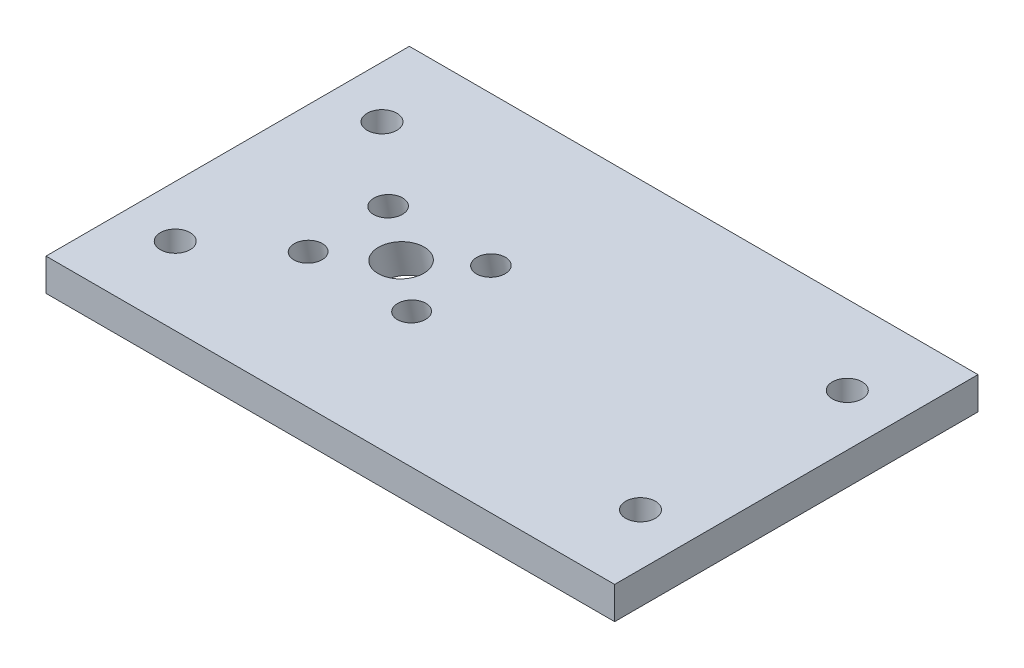
from build123d import *

# Parameters (mm, degrees)
SKETCH1_W           = 90
SKETCH1_H           = 56.23
BOSS_EXTRUDE1_DEPTH = 5
SKETCH2_R           = 2.3
CUT_EXTRUDE1_DEPTH  = 15
SKETCH7_R           = 2.3
CUT_EXTRUDE3_DEPTH  = 45
SKETCH9_W           = 61.183864123
SKETCH9_H           = 5.04390519
CUT_EXTRUDE4_DEPTH  = 2
SKETCH13_R          = 2.2
SKETCH13_R_2        = 2.159579804
SKETCH13_R_3        = 3.5
CUT_EXTRUDE5_DEPTH  = 20


with BuildPart() as part:
    # Sketch1 → Boss-Extrude1 (new body)
    with BuildSketch(Plane(origin=(0, 0, 0), x_dir=(1, 0, 0), z_dir=(0, 1, 0))):
        with Locations((45, 28.115)):
            Rectangle(SKETCH1_W, SKETCH1_H)
    extrude(amount=BOSS_EXTRUDE1_DEPTH)

    # Sketch2 → Cut-Extrude1 (cut)
    with BuildSketch(Plane(origin=(0, 5, 0), x_dir=(1, 0, 0), z_dir=(0, 1, 0))):
        with Locations((82, 12)):
            Circle(SKETCH2_R)
        with Locations((10, 12)):
            Circle(SKETCH2_R)
    extrude(amount=-CUT_EXTRUDE1_DEPTH, mode=Mode.SUBTRACT)

    # Sketch7 → Cut-Extrude3 (cut)
    with BuildSketch(Plane(origin=(0, 5, 0), x_dir=(1, 0, 0), z_dir=(0, 1, 0))):
        with Locations((82, 44)):
            Circle(SKETCH7_R)
        with Locations((10, 44)):
            Circle(SKETCH7_R)
    extrude(amount=-CUT_EXTRUDE3_DEPTH, mode=Mode.SUBTRACT)

    # Sketch9 → Cut-Extrude4 (cut)
    with BuildSketch(Plane.ZY):
        with Locations((-25.638067939, 2.521952595)):
            Rectangle(SKETCH9_W, SKETCH9_H)
    extrude(amount=-CUT_EXTRUDE4_DEPTH, mode=Mode.SUBTRACT)

    # Sketch13 → Cut-Extrude5 (cut)
    with BuildSketch(Plane(origin=(0, 4.817959636, 0.936516484), x_dir=(1, 0, 0), z_dir=(0, 0.9816271834476639, 0.19080899537654525))):
        with Locations((21.790317182, 33.498951741)):
            Circle(SKETCH13_R)
        with Locations((37.700491288, 33.498951741)):
            Circle(SKETCH13_R)
        with Locations((21.698973689, 21.438165219)):
            Circle(SKETCH13_R_2)
        with Locations((37.709597979, 21.438165219)):
            Circle(SKETCH13_R_2)
        with Locations((30.036708393, 27.372240429)):
            Circle(SKETCH13_R_3)
    extrude(amount=-CUT_EXTRUDE5_DEPTH, mode=Mode.SUBTRACT)


solid = part.part
